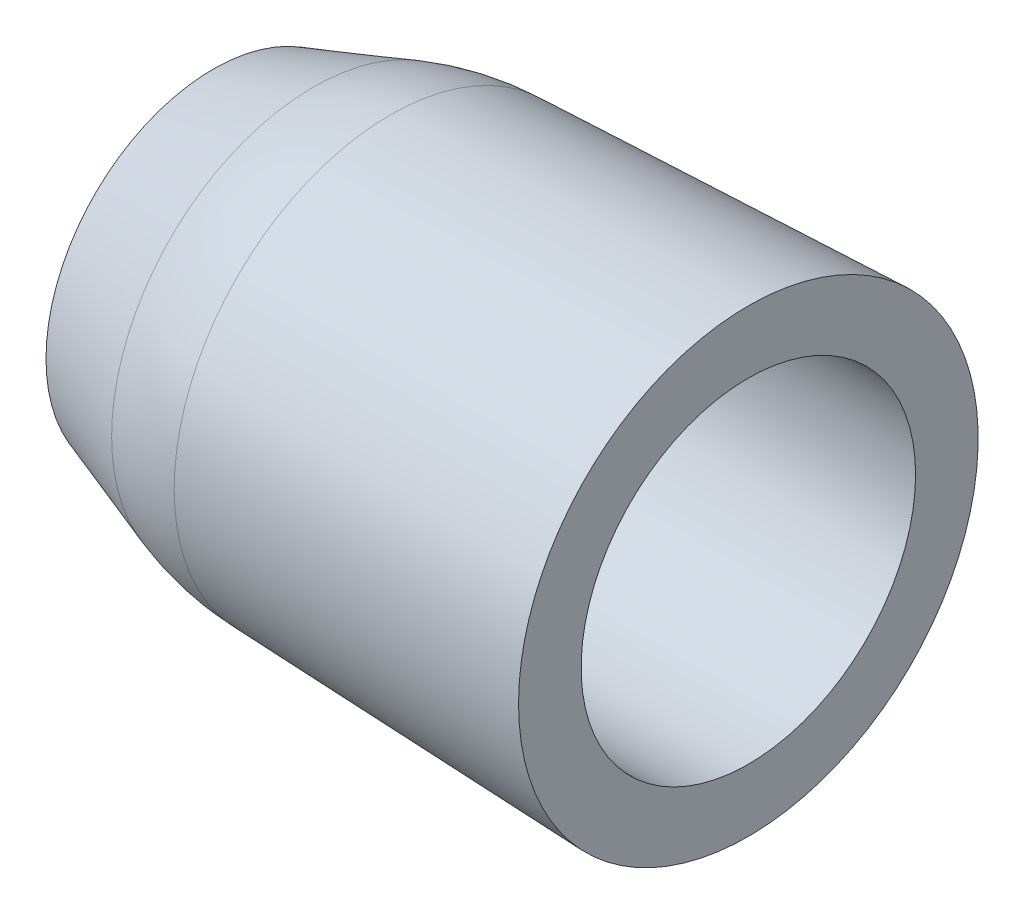
from build123d import *

# Parameters (mm, degrees)
SKETCH3_R          = 7.9375
CUT_EXTRUDE1_DEPTH = 25.146
FILLET1_R          = 12.7
SKETCH4_R          = 1.172289895
CUT_EXTRUDE2_DEPTH = 2.54


with BuildPart() as part:
    # Sketch2 → Revolve1 (revolve)
    with BuildSketch(Plane.XY):
        Polygon((-2.409498475, 0), (-2.409498475, 10.907816429), (-21.2812055, 10.186700377), (-27.809498475, 7.9375), (-27.809498475, 0), align=None)
    revolve(axis=Axis((-27.809498475, 0, 0), (1, 0, 0)))

    # Sketch3 → Cut-Extrude1 (cut)
    with BuildSketch(Plane(origin=(-2.409498475, 0, 0), x_dir=(0, 0, -1), z_dir=(1, 0, 0))):
        Circle(SKETCH3_R)
    extrude(amount=-CUT_EXTRUDE1_DEPTH, mode=Mode.SUBTRACT)

    # Fillet1
    fillet1_edges = [part.edges().sort_by_distance(p)[0] for p in [
        (-21.2812055, -10.186700377, 0),
    ]]
    fillet(fillet1_edges, radius=FILLET1_R)

    # Sketch4 → Cut-Extrude2 (cut)
    with BuildSketch(Plane(origin=(-27.555498475, 0, 0), x_dir=(0, 0, -1), z_dir=(1, 0, 0))):
        with Locations((-2.487698993, 4.115555717)):
            Circle(SKETCH4_R)
    extrude(amount=-CUT_EXTRUDE2_DEPTH, mode=Mode.SUBTRACT)


solid = part.part
